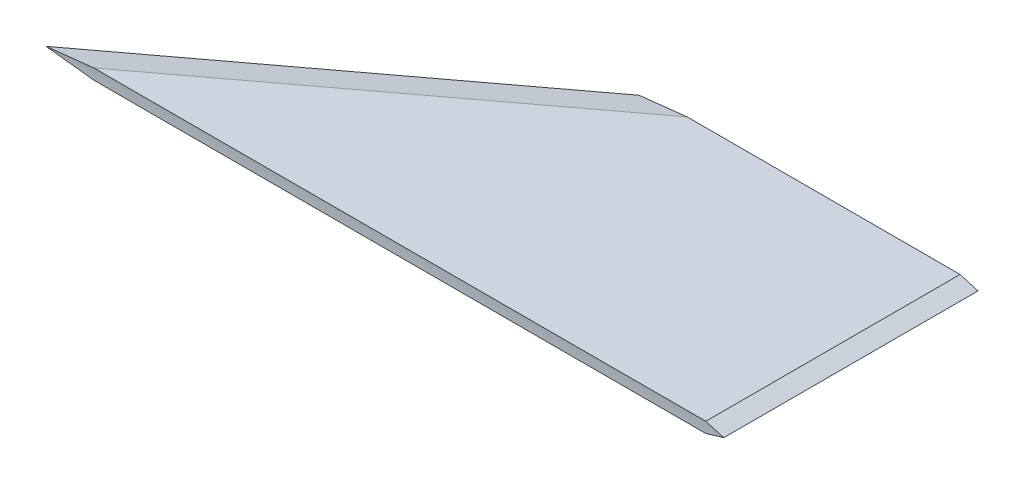
from build123d import *

# Parameters (mm, degrees)
BOSS_EXTRUDE1_DEPTH = 1.5875
BOSS_EXTRUDE2_DEPTH = 101.6
CUT_EXTRUDE1_DEPTH  = 153
CUT_EXTRUDE2_DEPTH  = 136


with BuildPart() as part:
    # Sketch1 → Boss-Extrude1 (new, symmetric)
    with BuildSketch(Plane(origin=(0, 0, 0), x_dir=(1, 0, 0), z_dir=(0, 1, 0))):
        Polygon((-101.6, 0), (101.6, 0), (101.6, 76.2), (0, 76.2), align=None)
    extrude(amount=BOSS_EXTRUDE1_DEPTH, both=True)

    # Sketch2 → Boss-Extrude2 (add, symmetric)
    with BuildSketch(Plane(origin=(0, 0, 0), x_dir=(0, 0, -1), z_dir=(1, 0, 0))):
        with BuildLine():
            Line((0, 0), (0, 1.5875))
            Line((0, 1.5875), (-0.031813653, 1.5875))
            ThreePointArc((-0.031813653, 1.5875), (-0.007954212, 0.793909371), (0, 0))
        make_face()
        with BuildLine():
            Line((0, -1.5875), (0, 0))
            ThreePointArc((0, 0), (-0.007954212, -0.793909371), (-0.031813653, -1.5875))
            Line((-0.031813653, -1.5875), (0, -1.5875))
        make_face()
    extrude(amount=BOSS_EXTRUDE2_DEPTH, both=True)

    # Sketch8 → Cut-Extrude1 (cut, symmetric)
    with BuildSketch(Plane(origin=(36.576, 0, -27.432), x_dir=(0, -1, 0), z_dir=(0.8000000000000019, 0, -0.5999999999999975))):
        Polygon((1.5875, 60.96), (0, 60.96), (1.5875, 52.254964672), align=None)
        Polygon((0, 60.96), (-1.5875, 60.96), (-1.5875, 52.297440868), align=None)
    extrude(amount=CUT_EXTRUDE1_DEPTH, both=True, mode=Mode.SUBTRACT)

    # Sketch9 → Cut-Extrude2 (cut)
    with BuildSketch(Plane(origin=(0, 0, -76.2), x_dir=(-1, 0, 0), z_dir=(0, 0, -1))):
        Polygon((-101.6, 1.5875), (-101.6, 0), (-96.226917965, 1.5875), align=None)
        Polygon((-96.226917965, -1.5875), (-101.6, 0), (-101.6, -1.5875), align=None)
    extrude(amount=-CUT_EXTRUDE2_DEPTH, mode=Mode.SUBTRACT)


solid = part.part
